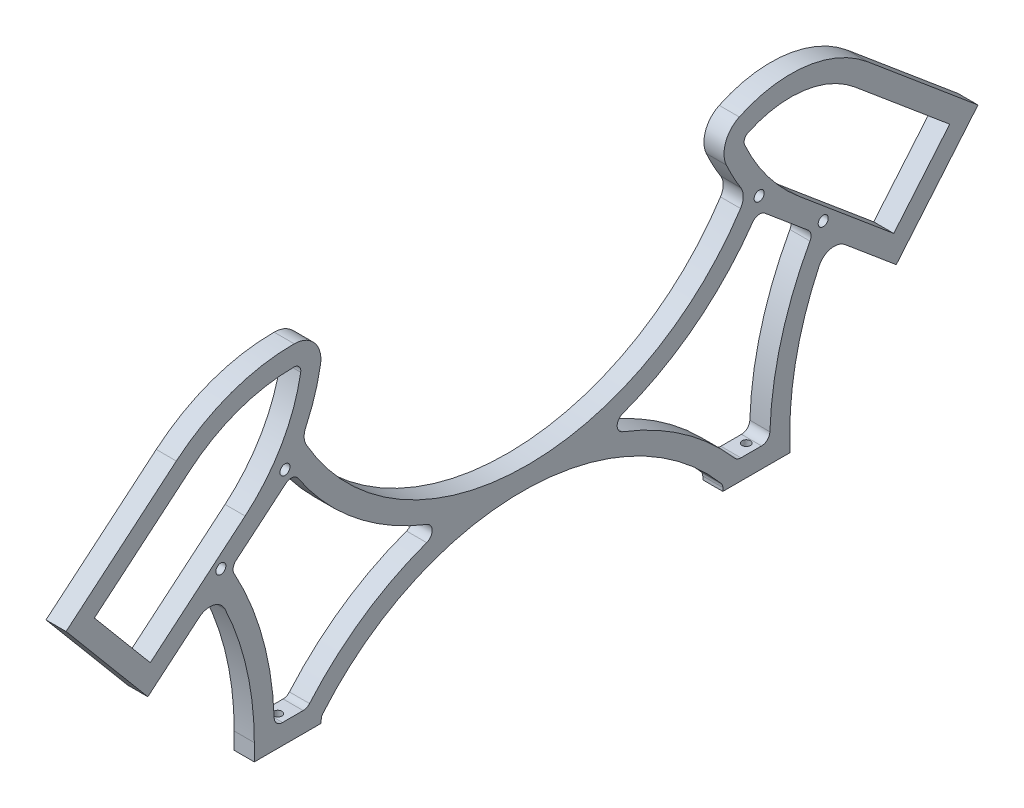
from build123d import *

# Parameters (mm, degrees)
SKETCH1_R                   = 1.5
BOSS_EXTRUDE1_DEPTH         = 6
TAP_DRILL_FOR_M3_TAP1_D     = 2.5
TAP_DRILL_FOR_M3_TAP1_DEPTH = 10
TAP_DRILL_FOR_M3_TAP1_TIP   = 0.751075774
FILLET1_R                   = 2.5


with BuildPart() as part:
    # Sketch1 → Boss-Extrude1 (new body)
    with BuildSketch(Plane(origin=(0, 0, 0), x_dir=(0, 0, -1), z_dir=(1, 0, 0))):
        with BuildLine():
            Line((0, 0), (0, 5))
            ThreePointArc((0, 5), (-2.218703253, 24.958999668), (-8.766483617, 43.94349029))
            ThreePointArc((-8.766483617, 43.94349029), (-12.217864791, 46.685953094), (-16.498126045, 45.631202964))
            Line((-16.498126045, 45.631202964), (-31.819014908, 32.77545077))
            Line((-31.819014908, 32.77545077), (-56.244944076, 61.885139609))
            Line((-56.244944076, 61.885139609), (-23.305033022, 89.525006825))
            ThreePointArc((-23.305033022, 89.525006825), (-6.818865856, 99.017171366), (11.92732781, 102.253700147))
            ThreePointArc((11.92732781, 102.253700147), (18.017620401, 99.396091574), (19.774247269, 92.902105691))
            ThreePointArc((19.774247269, 92.902105691), (18.044454009, 85.7535683), (15.36635808, 78.903635909))
            ThreePointArc((15.36635808, 78.903635909), (14.893316595, 76.574631948), (15.548996464, 74.290313317))
            ThreePointArc((15.548996464, 74.290313317), (79.378062963, 36.031165894), (145.292210727, 70.574431756))
            ThreePointArc((145.292210727, 70.574431756), (146.100819949, 73.26099096), (145.335189449, 75.960112887))
            ThreePointArc((145.335189449, 75.960112887), (143.061354254, 79.870498082), (141.059139986, 83.926675702))
            ThreePointArc((141.059139986, 83.926675702), (140.838941665, 89.977140026), (144.92035201, 94.449130124))
            ThreePointArc((144.92035201, 94.449130124), (164.83474505, 97.615635132), (183.305033022, 89.525006825))
            Line((183.305033022, 89.525006825), (216.244944076, 61.885139609))
            Line((216.244944076, 61.885139609), (191.819014908, 32.77545077))
            Line((191.819014908, 32.77545077), (176.498126045, 45.631202964))
            ThreePointArc((176.498126045, 45.631202964), (172.217864791, 46.685953094), (168.766483617, 43.94349029))
            ThreePointArc((168.766483617, 43.94349029), (162.218703253, 24.958999668), (160, 5))
            Line((160, 5), (160, 0))
            Line((160, 0), (140, 0))
            Line((140, 0), (140, 1))
            ThreePointArc((140, 1), (139.878940602, 1.68526069), (139.530417786, 2.287564134))
            ThreePointArc((139.530417786, 2.287564134), (80, 30), (20.469582214, 2.287564134))
            ThreePointArc((20.469582214, 2.287564134), (20.121059398, 1.68526069), (20, 1))
            Line((20, 1), (20, 0))
            Line((20, 0), (0, 0))
        make_face()
        with Locations((-10, 55)):
            Circle(SKETCH1_R, mode=Mode.SUBTRACT)
        with Locations((170, 55)):
            Circle(SKETCH1_R, mode=Mode.SUBTRACT)
        with Locations((9.151111078, 71.069690242)):
            Circle(SKETCH1_R, mode=Mode.SUBTRACT)
        with Locations((150.848888922, 71.069690242)):
            Circle(SKETCH1_R, mode=Mode.SUBTRACT)
        with BuildLine():
            Line((167.048585232, 53.560309176), (150.44481415, 67.492527366))
            ThreePointArc((150.44481415, 67.492527366), (129.875879385, 45.741185315), (102.8722587, 32.818088617))
            ThreePointArc((102.8722587, 32.818088617), (125.577164667, 22.52113635), (144.247784225, 6))
            Line((144.247784225, 6), (154.005161008, 6))
            ThreePointArc((154.005161008, 6), (157.449996647, 30.623988571), (167.048585232, 53.560309176))
        make_face(mode=Mode.SUBTRACT)
        with BuildLine():
            Line((11.590311816, 69.200200814), (-7.048585232, 53.560309176))
            ThreePointArc((-7.048585232, 53.560309176), (2.550003353, 30.623988571), (5.994838992, 6))
            Line((5.994838992, 6), (15.752215775, 6))
            ThreePointArc((15.752215775, 6), (35.109017872, 22.961169717), (58.700378984, 33.247799217))
            ThreePointArc((58.700378984, 33.247799217), (31.785524824, 46.821474287), (11.590311816, 69.200200814))
        make_face(mode=Mode.SUBTRACT)
        with BuildLine():
            Line((162.735829512, 65.011584646), (191.079473907, 41.228443087))
            Line((191.079473907, 41.228443087), (207.791951759, 61.145598608))
            Line((207.791951759, 61.145598608), (179.448307363, 84.928740167))
            ThreePointArc((179.448307363, 84.928740167), (164.071299974, 91.664404031), (147.492036597, 89.028204152))
            ThreePointArc((147.492036597, 89.028204152), (146.471684011, 87.910206628), (146.526733591, 86.397590547))
            ThreePointArc((146.526733591, 86.397590547), (153.428049816, 74.792622141), (162.735829512, 65.011584646))
        make_face(mode=Mode.SUBTRACT)
        with BuildLine():
            Line((-19.448307363, 84.928740167), (-47.791951759, 61.145598608))
            Line((-47.791951759, 61.145598608), (-31.079473907, 41.228443087))
            Line((-31.079473907, 41.228443087), (-2.735829512, 65.011584646))
            ThreePointArc((-2.735829512, 65.011584646), (8.128371721, 77.990356324), (13.860510459, 93.915869445))
            ThreePointArc((13.860510459, 93.915869445), (13.421353742, 95.539365916), (11.898780595, 96.253768059))
            ThreePointArc((11.898780595, 96.253768059), (-4.780163644, 93.374149721), (-19.448307363, 84.928740167))
        make_face(mode=Mode.SUBTRACT)
    extrude(amount=BOSS_EXTRUDE1_DEPTH)

    # Tap Drill for M3 Tap1
    with Locations(Plane(origin=(0, 0, 0), x_dir=(-1, 0, 0), z_dir=(0, -1, 0))):
        with Locations((-3, 10), (-3, 150)):
            Hole(TAP_DRILL_FOR_M3_TAP1_D / 2, depth=TAP_DRILL_FOR_M3_TAP1_DEPTH)
            with Locations((0, 0, -(TAP_DRILL_FOR_M3_TAP1_DEPTH + TAP_DRILL_FOR_M3_TAP1_TIP / 2))):  # 118° drill point
                Cone(0, TAP_DRILL_FOR_M3_TAP1_D / 2, TAP_DRILL_FOR_M3_TAP1_TIP, mode=Mode.SUBTRACT)

    # Fillet1
    fillet1_edges = [part.edges().sort_by_distance(p)[0] for p in [
        (3, 6, -15.752215775),
        (3, 6, -5.994838992),
        (3, 53.560309176, 7.048585232),
        (3, 69.200200814, -11.590311816),
        (3, 53.560309176, -167.048585232),
        (3, 6, -154.005161008),
        (3, 67.492527366, -150.44481415),
        (3, 33.247799217, -58.700378984),
        (3, 6, -144.247784225),
        (3, 32.818088617, -102.8722587),
    ]]
    fillet(fillet1_edges, radius=FILLET1_R)


solid = part.part
